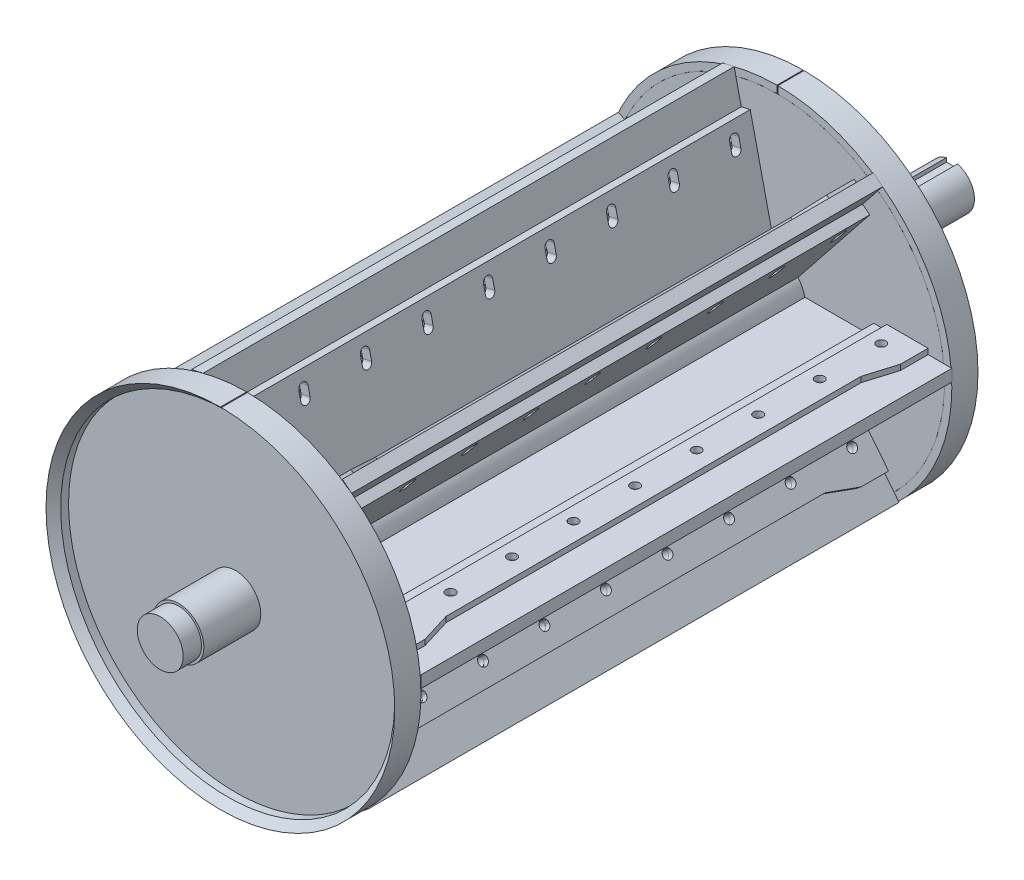
from build123d import *

# Parameters (mm, degrees)
SKETCH1_R                = 189.85
BOSS_EXTRUDE1_DEPTH      = 24
SKETCH2_R                = 189.85
BOSS_EXTRUDE2_DEPTH      = 24
BOSS_EXTRUDE3_REACH      = 661.159
SKETCH3_R                = 30
SKETCH5_R                = 27.5
BOSS_EXTRUDE4_DEPTH      = 50
SKETCH6_R                = 27.5
BOSS_EXTRUDE5_DEPTH      = 50
SKETCH16_R               = 186.07405166
SKETCH16_R_2             = 27.5
CUT_EXTRUDE2_DEPTH       = 12
SKETCH18_R               = 186.07405166
SKETCH18_R_2             = 27.5
CUT_EXTRUDE3_DEPTH       = 12
BOSS_EXTRUDE6_DEPTH      = 5
BOSS_EXTRUDE6_DEPTH_BACK = 5
SKETCH8_W                = 85
SKETCH8_H                = 578.150129005
SKETCH8_R                = 5
BOSS_EXTRUDE8_DEPTH      = 13
SKETCH9_R                = 5
BOSS_EXTRUDE9_DEPTH      = 6
CIRPATTERN1_COUNT        = 7
SKETCH10_R               = 25
BOSS_EXTRUDE10_DEPTH     = 45
SKETCH12_R               = 24.5
BOSS_EXTRUDE11_DEPTH     = 71
SKETCH13_W               = 12
SKETCH13_H               = 10
CUT_EXTRUDE1_DEPTH       = 70
FILLET1_R                = 6
SKETCH14_R               = 25
BOSS_EXTRUDE12_DEPTH     = 20
CUT_EXTRUDE4_DEPTH       = 40
CUT_EXTRUDE4_DEPTH_BACK  = 12
SKETCH19_R               = 189.85
SKETCH19_R_2             = 181.85
BASE_FLANGE1_DEPTH       = 28.5
CHAMFER1_SIZE            = 8
CUT_EXTRUDE5_DEPTH       = 30
CUT_EXTRUDE5_DEPTH_BACK  = 12
SKETCH21_R               = 189.85
SKETCH21_R_2             = 181.85
BASE_FLANGE2_DEPTH       = 28.5
CHAMFER2_SIZE            = 8


# Sheet-metal steps are written as plain solids
# Some blends are built 0.0001 mm under size
with BuildPart() as part:
    # Sketch1 → Boss-Extrude1 (new body)
    with BuildSketch(Plane.XY):
        Circle(SKETCH1_R)
    extrude(amount=BOSS_EXTRUDE1_DEPTH)


with BuildPart() as body_2:
    # Sketch2 → Boss-Extrude2 (new body)
    with BuildSketch(Plane(origin=(0, 0, 626), x_dir=(-1, 0, 0), z_dir=(0, 0, -1))):
        with Locations(Location((0, 0, 0), (0, 0, 180))):
            Circle(SKETCH2_R)
    extrude(amount=BOSS_EXTRUDE2_DEPTH)

    # Sketch3 → Boss-Extrude3 (add, up to next)
    with BuildSketch(Plane.XY.offset(24), mode=Mode.PRIVATE) as boss_extrude3_sk1:
        with Locations(Location((0, 0, 0), (0, 0, 180))):
            Circle(SKETCH3_R)
    boss_extrude3_tool1 = extrude(boss_extrude3_sk1.sketch, amount=BOSS_EXTRUDE3_REACH, mode=Mode.PRIVATE) - body_2.part

    add(part.part)  # Boss-Extrude3 merges part
    add(boss_extrude3_tool1.solids().sort_by_distance((0, 0, 24))[0])

    # Sketch4 → Revolve1 (revolve)
    with BuildSketch(Plane(origin=(0, 0, 0), x_dir=(1, 0, 0), z_dir=(0, 1, 0)), mode=Mode.PRIVATE) as revolve1_sk:
        Polygon((189.85, -626), (189.85, -630.5), (186.07405166, -626), align=None)
        Polygon((186.07405166, 0), (189.85, 0), (189.85, 4.5), align=None)
    revolve(revolve1_sk.sketch.rotate(Axis((0, 0, 0), (0, 0, 1)), 180), axis=Axis((0, 0, 0), (0, 0, 1)))

    # Sketch5 → Boss-Extrude4 (add)
    with BuildSketch(Plane(origin=(0, 0, 0), x_dir=(-1, 0, 0), z_dir=(0, 0, -1))):
        with Locations(Location((0, 0, 0), (0, 0, 180))):
            Circle(SKETCH5_R)
    extrude(amount=BOSS_EXTRUDE4_DEPTH)

    # Sketch6 → Boss-Extrude5 (add)
    with BuildSketch(Plane.XY.offset(626)):
        Circle(SKETCH6_R)
    extrude(amount=BOSS_EXTRUDE5_DEPTH)

    # Sketch16 → Cut-Extrude2 (cut)
    with BuildSketch(Plane.XY.offset(626)):
        Circle(SKETCH16_R)
        Circle(SKETCH16_R_2, mode=Mode.SUBTRACT)
    extrude(amount=-CUT_EXTRUDE2_DEPTH, mode=Mode.SUBTRACT)

    # Sketch18 → Cut-Extrude3 (cut)
    with BuildSketch(Plane(origin=(0, 0, 0), x_dir=(-1, 0, 0), z_dir=(0, 0, -1))):
        with Locations(Location((0, 0, 0), (0, 0, 180))):
            Circle(SKETCH18_R)
        with Locations(Location((0, 0, 0), (0, 0, 180))):
            Circle(SKETCH18_R_2, mode=Mode.SUBTRACT)
    extrude(amount=-CUT_EXTRUDE3_DEPTH, mode=Mode.SUBTRACT)

    # Sketch10 → Boss-Extrude10 (add)
    with BuildSketch(Plane(origin=(0, 0, -50), x_dir=(-1, 0, 0), z_dir=(0, 0, -1))):
        with Locations(Location((0, 0, 0), (0, 0, 180))):
            Circle(SKETCH10_R)
    extrude(amount=BOSS_EXTRUDE10_DEPTH)

    # Sketch12 → Boss-Extrude11 (add)
    with BuildSketch(Plane(origin=(0, 0, -95), x_dir=(-1, 0, 0), z_dir=(0, 0, -1))):
        Circle(SKETCH12_R)
    extrude(amount=BOSS_EXTRUDE11_DEPTH)

    # Sketch13 → Cut-Extrude1 (cut)
    with BuildSketch(Plane(origin=(0, 0, -166), x_dir=(-1, 0, 0), z_dir=(0, 0, -1))):
        with Locations((0, 24.5)):
            Rectangle(SKETCH13_W, SKETCH13_H)
    extrude(amount=-CUT_EXTRUDE1_DEPTH, mode=Mode.SUBTRACT)

    # Fillet1
    # the kernel refuses this fillet: 6 mm, written as the material it adds along each edge
    with BuildSketch(Plane(origin=(6, 38.75394704, -96), x_dir=(0, 0, -1), z_dir=(0, -1, 0))) as fillet1_piece_1_section:
        with BuildLine():
            CenterArc((FILLET1_R, -FILLET1_R), FILLET1_R, 90, 90)
            Line((0, -FILLET1_R), (0, 0))
            Line((0, 0), (FILLET1_R, 0))
        make_face()
    fillet1_piece_1 = extrude(amount=34.25394704, mode=Mode.PRIVATE)
    fillet1_piece_1 = fillet1_piece_1 & Plane(origin=(0, 0, -97.319866537), x_dir=(-1, 0, 0), z_dir=(0, 0, 1)) * Cylinder(24.5, 93, mode=Mode.PRIVATE)
    add(fillet1_piece_1)
    with BuildSketch(Plane(origin=(-6, 4.5, -96), x_dir=(1, 0, 0), z_dir=(0, 1, 0))) as fillet1_piece_2_section:
        with BuildLine():
            CenterArc((FILLET1_R, FILLET1_R), FILLET1_R, 180, 90)
            Line((0, FILLET1_R), (0, 0))
            Line((0, 0), (FILLET1_R, 0))
        make_face()
    fillet1_piece_2 = extrude(amount=34.25394704, mode=Mode.PRIVATE)
    fillet1_piece_2 = fillet1_piece_2 & Plane(origin=(0, 0, -97.358370686), x_dir=(-1, 0, 0), z_dir=(0, 0, 1)) * Cylinder(24.5, 93, mode=Mode.PRIVATE)
    add(fillet1_piece_2)

    # Sketch14 → Boss-Extrude12 (add)
    with BuildSketch(Plane.XY.offset(676)):
        Circle(SKETCH14_R)
    extrude(amount=BOSS_EXTRUDE12_DEPTH)


with BuildPart() as body_2_2:
    # Sketch7 → Boss-Extrude6 (new, two sides: drawn at the far end of the back side and taken through both)
    with BuildSketch(Plane(origin=(0, 0, 0), x_dir=(1, 0, 0), z_dir=(0, 1, 0)).offset(-BOSS_EXTRUDE6_DEPTH_BACK)):
        Polygon((30, -24), (30, -602), (155, -602), (155, -539), (155, -87), (155, -24), align=None)
        with BuildLine():
            Line((129, -308), (139, -308))
            ThreePointArc((139, -308), (144, -313), (139, -318))
            Line((139, -318), (129, -318))
            ThreePointArc((129, -318), (124, -313), (129, -308))
        make_face(mode=Mode.SUBTRACT)
        with BuildLine():
            Line((129, -241), (139, -241))
            ThreePointArc((139, -241), (144, -246), (139, -251))
            Line((139, -251), (129, -251))
            ThreePointArc((129, -251), (124, -246), (129, -241))
        make_face(mode=Mode.SUBTRACT)
        with BuildLine():
            Line((129, -174), (139, -174))
            ThreePointArc((139, -174), (144, -179), (139, -184))
            Line((139, -184), (129, -184))
            ThreePointArc((129, -184), (124, -179), (129, -174))
        make_face(mode=Mode.SUBTRACT)
        with BuildLine():
            Line((129, -107), (139, -107))
            ThreePointArc((139, -107), (144, -112), (139, -117))
            Line((139, -117), (129, -117))
            ThreePointArc((129, -117), (124, -112), (129, -107))
        make_face(mode=Mode.SUBTRACT)
        with BuildLine():
            Line((129, -40), (139, -40))
            ThreePointArc((139, -40), (144, -45), (139, -50))
            Line((139, -50), (129, -50))
            ThreePointArc((129, -50), (124, -45), (129, -40))
        make_face(mode=Mode.SUBTRACT)
        with BuildLine():
            Line((129, -385), (139, -385))
            ThreePointArc((139, -385), (144, -380), (139, -375))
            Line((139, -375), (129, -375))
            ThreePointArc((129, -375), (124, -380), (129, -385))
        make_face(mode=Mode.SUBTRACT)
        with BuildLine():
            Line((129, -452), (139, -452))
            ThreePointArc((139, -452), (144, -447), (139, -442))
            Line((139, -442), (129, -442))
            ThreePointArc((129, -442), (124, -447), (129, -452))
        make_face(mode=Mode.SUBTRACT)
        with BuildLine():
            Line((129, -519), (139, -519))
            ThreePointArc((139, -519), (144, -514), (139, -509))
            Line((139, -509), (129, -509))
            ThreePointArc((129, -509), (124, -514), (129, -519))
        make_face(mode=Mode.SUBTRACT)
        with BuildLine():
            Line((129, -586), (139, -586))
            ThreePointArc((139, -586), (144, -581), (139, -576))
            Line((139, -576), (129, -576))
            ThreePointArc((129, -576), (124, -581), (129, -586))
        make_face(mode=Mode.SUBTRACT)
    extrude(amount=BOSS_EXTRUDE6_DEPTH + BOSS_EXTRUDE6_DEPTH_BACK)


with BuildPart() as body_3:
    # Sketch8 → Boss-Extrude8 (new body)
    with BuildSketch(Plane(origin=(0, 5, 0), x_dir=(1, 0, 0), z_dir=(0, 1, 0))):
        with Locations((147.35, -312.976376086)):
            Rectangle(SKETCH8_W, SKETCH8_H)
        with Locations(Location((134, -313, 0), (0, 0, 90))):
            Circle(SKETCH8_R, mode=Mode.SUBTRACT)
        with Locations(Location((134, -246, 0), (0, 0, 90))):
            Circle(SKETCH8_R, mode=Mode.SUBTRACT)
        with Locations(Location((134, -179, 0), (0, 0, 90))):
            Circle(SKETCH8_R, mode=Mode.SUBTRACT)
        with Locations(Location((134, -112, 0), (0, 0, 90))):
            Circle(SKETCH8_R, mode=Mode.SUBTRACT)
        with Locations(Location((134, -45, 0), (0, 0, 90))):
            Circle(SKETCH8_R, mode=Mode.SUBTRACT)
        with Locations(Location((134, -581, 0), (0, 0, 90))):
            Circle(SKETCH8_R, mode=Mode.SUBTRACT)
        with Locations(Location((134, -514, 0), (0, 0, 90))):
            Circle(SKETCH8_R, mode=Mode.SUBTRACT)
        with Locations(Location((134, -447, 0), (0, 0, 90))):
            Circle(SKETCH8_R, mode=Mode.SUBTRACT)
        with Locations(Location((134, -380, 0), (0, 0, 90))):
            Circle(SKETCH8_R, mode=Mode.SUBTRACT)
    extrude(amount=BOSS_EXTRUDE8_DEPTH)


with BuildPart() as body_4:
    # Sketch9 → Boss-Extrude9 (new body)
    with BuildSketch(Plane(origin=(0, 18, 0), x_dir=(1, 0, 0), z_dir=(0, 1, 0))):
        Polygon((119, -23.901311583), (119, -602.051440588), (163.351859714, -602.051440588), (164.473330949, -602.049178765), (164.424208848, -572.049218982), (154.370187942, -539.065637254), (154, -86.901311583), (164, -53.901311583), (164, -23.901311583), align=None)
        with BuildLine():
            ThreePointArc((134.215322484, -576.004638529), (139.438822426, -580.995547223), (134.223501618, -585.995002205))
            ThreePointArc((134.223501618, -585.995002205), (129.000001676, -581.00409351), (134.215322484, -576.004638529))
        make_face(mode=Mode.SUBTRACT)
        with BuildLine():
            ThreePointArc((134.160467745, -509.002575653), (139.329116401, -513.99563704), (134.168650331, -518.997154897))
            ThreePointArc((134.168650331, -518.997154897), (129.000001676, -514.004093511), (134.160467745, -509.002575653))
        make_face(mode=Mode.SUBTRACT)
        with BuildLine():
            ThreePointArc((134.105613499, -442.001115546), (139.219410375, -446.995726856), (134.113798551, -451.998704821))
            ThreePointArc((134.113798551, -451.998704821), (129.000001676, -447.004093511), (134.105613499, -442.001115546))
        make_face(mode=Mode.SUBTRACT)
        with BuildLine():
            ThreePointArc((134.050759746, -375.000257662), (139.10970435, -379.995816671), (134.058946278, -384.999652522))
            ThreePointArc((134.058946278, -384.999652522), (129.000001676, -380.004093512), (134.050759746, -375.000257662))
        make_face(mode=Mode.SUBTRACT)
        with Locations(Location((134, -313, 0), (0, 0, 270))):
            Circle(SKETCH9_R, mode=Mode.SUBTRACT)
        with Locations(Location((134, -246, 0), (0, 0, 270))):
            Circle(SKETCH9_R, mode=Mode.SUBTRACT)
        with Locations(Location((134, -179, 0), (0, 0, 270))):
            Circle(SKETCH9_R, mode=Mode.SUBTRACT)
        with Locations(Location((134, -112, 0), (0, 0, 270))):
            Circle(SKETCH9_R, mode=Mode.SUBTRACT)
        with Locations(Location((134, -45, 0), (0, 0, 270))):
            Circle(SKETCH9_R, mode=Mode.SUBTRACT)
    extrude(amount=BOSS_EXTRUDE9_DEPTH)


with BuildPart() as cirpattern1_1:
    # CirPattern1: pattern copy
    add(body_4.part.rotate(Axis((0, 0, 0), (0, 0, 1)), 1 * 360 / CIRPATTERN1_COUNT))


with BuildPart() as cirpattern1_2:
    # CirPattern1: pattern copy
    add(body_4.part.rotate(Axis((0, 0, 0), (0, 0, 1)), 2 * 360 / CIRPATTERN1_COUNT))


with BuildPart() as cirpattern1_3:
    # CirPattern1: pattern copy
    add(body_4.part.rotate(Axis((0, 0, 0), (0, 0, 1)), 3 * 360 / CIRPATTERN1_COUNT))


with BuildPart() as cirpattern1_4:
    # CirPattern1: pattern copy
    add(body_4.part.rotate(Axis((0, 0, 0), (0, 0, 1)), 4 * 360 / CIRPATTERN1_COUNT))


with BuildPart() as cirpattern1_5:
    # CirPattern1: pattern copy
    add(body_4.part.rotate(Axis((0, 0, 0), (0, 0, 1)), 5 * 360 / CIRPATTERN1_COUNT))


with BuildPart() as cirpattern1_6:
    # CirPattern1: pattern copy
    add(body_4.part.rotate(Axis((0, 0, 0), (0, 0, 1)), 6 * 360 / CIRPATTERN1_COUNT))


with BuildPart() as cirpattern1_7:
    # CirPattern1: pattern copy
    add(body_3.part.rotate(Axis((0, 0, 0), (0, 0, 1)), 1 * 360 / CIRPATTERN1_COUNT))


with BuildPart() as cirpattern1_8:
    # CirPattern1: pattern copy
    add(body_3.part.rotate(Axis((0, 0, 0), (0, 0, 1)), 2 * 360 / CIRPATTERN1_COUNT))


with BuildPart() as cirpattern1_9:
    # CirPattern1: pattern copy
    add(body_3.part.rotate(Axis((0, 0, 0), (0, 0, 1)), 3 * 360 / CIRPATTERN1_COUNT))


with BuildPart() as cirpattern1_10:
    # CirPattern1: pattern copy
    add(body_3.part.rotate(Axis((0, 0, 0), (0, 0, 1)), 4 * 360 / CIRPATTERN1_COUNT))


with BuildPart() as cirpattern1_11:
    # CirPattern1: pattern copy
    add(body_3.part.rotate(Axis((0, 0, 0), (0, 0, 1)), 5 * 360 / CIRPATTERN1_COUNT))


with BuildPart() as cirpattern1_12:
    # CirPattern1: pattern copy
    add(body_3.part.rotate(Axis((0, 0, 0), (0, 0, 1)), 6 * 360 / CIRPATTERN1_COUNT))


with BuildPart() as cirpattern1_13:
    # CirPattern1: pattern copy
    add(body_2_2.part.rotate(Axis((0, 0, 0), (0, 0, 1)), 1 * 360 / CIRPATTERN1_COUNT))


with BuildPart() as cirpattern1_14:
    # CirPattern1: pattern copy
    add(body_2_2.part.rotate(Axis((0, 0, 0), (0, 0, 1)), 2 * 360 / CIRPATTERN1_COUNT))


with BuildPart() as cirpattern1_15:
    # CirPattern1: pattern copy
    add(body_2_2.part.rotate(Axis((0, 0, 0), (0, 0, 1)), 3 * 360 / CIRPATTERN1_COUNT))


with BuildPart() as cirpattern1_16:
    # CirPattern1: pattern copy
    add(body_2_2.part.rotate(Axis((0, 0, 0), (0, 0, 1)), 4 * 360 / CIRPATTERN1_COUNT))


with BuildPart() as cirpattern1_17:
    # CirPattern1: pattern copy
    add(body_2_2.part.rotate(Axis((0, 0, 0), (0, 0, 1)), 5 * 360 / CIRPATTERN1_COUNT))


with BuildPart() as cirpattern1_18:
    # CirPattern1: pattern copy
    add(body_2_2.part.rotate(Axis((0, 0, 0), (0, 0, 1)), 6 * 360 / CIRPATTERN1_COUNT))


with BuildPart() as cut_extrude4_tool:
    # Sketch19 → Cut-Extrude4 (new, two sides: drawn at the far end of the back side and taken through both)
    with BuildSketch(Plane(origin=(0, 0, 12), x_dir=(-1, 0, 0), z_dir=(0, 0, -1)).offset(-CUT_EXTRUDE4_DEPTH_BACK)):
        Circle(SKETCH19_R)
        Circle(SKETCH19_R_2, mode=Mode.SUBTRACT)
    extrude(amount=CUT_EXTRUDE4_DEPTH + CUT_EXTRUDE4_DEPTH_BACK)


with BuildPart() as body_2_1:
    add(body_2.part)

    # Cut-Extrude4: cut by cut_extrude4_tool
    add(cut_extrude4_tool.part, mode=Mode.SUBTRACT)


with BuildPart() as body_3_1:
    add(body_3.part)

    # Cut-Extrude4: cut by cut_extrude4_tool
    add(cut_extrude4_tool.part, mode=Mode.SUBTRACT)


with BuildPart() as cirpattern1_7_1:
    add(cirpattern1_7.part)

    # Cut-Extrude4: cut by cut_extrude4_tool
    add(cut_extrude4_tool.part, mode=Mode.SUBTRACT)


with BuildPart() as cirpattern1_8_1:
    add(cirpattern1_8.part)

    # Cut-Extrude4: cut by cut_extrude4_tool
    add(cut_extrude4_tool.part, mode=Mode.SUBTRACT)


with BuildPart() as cirpattern1_9_1:
    add(cirpattern1_9.part)

    # Cut-Extrude4: cut by cut_extrude4_tool
    add(cut_extrude4_tool.part, mode=Mode.SUBTRACT)


with BuildPart() as cirpattern1_10_1:
    add(cirpattern1_10.part)

    # Cut-Extrude4: cut by cut_extrude4_tool
    add(cut_extrude4_tool.part, mode=Mode.SUBTRACT)


with BuildPart() as cirpattern1_11_1:
    add(cirpattern1_11.part)

    # Cut-Extrude4: cut by cut_extrude4_tool
    add(cut_extrude4_tool.part, mode=Mode.SUBTRACT)


with BuildPart() as cirpattern1_12_1:
    add(cirpattern1_12.part)

    # Cut-Extrude4: cut by cut_extrude4_tool
    add(cut_extrude4_tool.part, mode=Mode.SUBTRACT)


with BuildPart() as body_23:
    # Sketch20 → Base-Flange1 (new body)
    with BuildSketch(Plane.XY.offset(24)):
        with BuildLine():
            ThreePointArc((-0.499999528, 181.84931262), (0, -181.85), (0.499999528, 181.84931262))
            Line((0.499999528, 181.84931262), (0.521995657, 189.849282381))
            ThreePointArc((0.521995657, 189.849282381), (0, -189.85), (-0.521995657, 189.849282381))
            Line((-0.521995657, 189.849282381), (-0.499999528, 181.84931262))
        make_face()
    extrude(amount=-BASE_FLANGE1_DEPTH)

    # Chamfer1
    chamfer1_edges = [body_23.edges().sort_by_distance(p)[0] for p in [
        (0, -181.85, -4.5),
    ]]
    chamfer(chamfer1_edges, length=CHAMFER1_SIZE - 0.0001)  # a hair under: the kernel refuses the full size


with BuildPart() as cut_extrude5_tool:
    # Sketch21 → Cut-Extrude5 (new, two sides: drawn at the far end of the back side and taken through both)
    with BuildSketch(Plane.XY.offset(614).offset(-CUT_EXTRUDE5_DEPTH_BACK)):
        Circle(SKETCH21_R)
        with Locations(Location((0, 0, 0), (0, 0, 180))):
            Circle(SKETCH21_R_2, mode=Mode.SUBTRACT)
    extrude(amount=CUT_EXTRUDE5_DEPTH + CUT_EXTRUDE5_DEPTH_BACK)


with BuildPart() as body_2_3:
    add(body_2_1.part)

    # Cut-Extrude5: cut by cut_extrude5_tool
    add(cut_extrude5_tool.part, mode=Mode.SUBTRACT)


with BuildPart() as body_3_2:
    add(body_3_1.part)

    # Cut-Extrude5: cut by cut_extrude5_tool
    add(cut_extrude5_tool.part, mode=Mode.SUBTRACT)


with BuildPart() as cirpattern1_7_2:
    add(cirpattern1_7_1.part)

    # Cut-Extrude5: cut by cut_extrude5_tool
    add(cut_extrude5_tool.part, mode=Mode.SUBTRACT)


with BuildPart() as cirpattern1_8_2:
    add(cirpattern1_8_1.part)

    # Cut-Extrude5: cut by cut_extrude5_tool
    add(cut_extrude5_tool.part, mode=Mode.SUBTRACT)


with BuildPart() as cirpattern1_9_2:
    add(cirpattern1_9_1.part)

    # Cut-Extrude5: cut by cut_extrude5_tool
    add(cut_extrude5_tool.part, mode=Mode.SUBTRACT)


with BuildPart() as cirpattern1_10_2:
    add(cirpattern1_10_1.part)

    # Cut-Extrude5: cut by cut_extrude5_tool
    add(cut_extrude5_tool.part, mode=Mode.SUBTRACT)


with BuildPart() as cirpattern1_11_2:
    add(cirpattern1_11_1.part)

    # Cut-Extrude5: cut by cut_extrude5_tool
    add(cut_extrude5_tool.part, mode=Mode.SUBTRACT)


with BuildPart() as cirpattern1_12_2:
    add(cirpattern1_12_1.part)

    # Cut-Extrude5: cut by cut_extrude5_tool
    add(cut_extrude5_tool.part, mode=Mode.SUBTRACT)


with BuildPart() as body_24:
    # Sketch23 → Base-Flange2 (new body)
    with BuildSketch(Plane(origin=(0, 0, 602), x_dir=(-1, 0, 0), z_dir=(0, 0, -1))):
        with BuildLine():
            ThreePointArc((-0.999995275, 181.847250486), (0.499999528, -181.84931262), (0, 181.85))
            Line((0, 181.85), (0, 189.85))
            ThreePointArc((0, 189.85), (0.521995657, -189.849282381), (-1.043987369, 189.847129529))
            Line((-1.043987369, 189.847129529), (-0.999995275, 181.847250486))
        make_face()
    extrude(amount=-BASE_FLANGE2_DEPTH)

    # Chamfer2
    chamfer2_edges = [body_24.edges().sort_by_distance(p)[0] for p in [
        (-0.499999528, -181.84931262, 630.5),
    ]]
    chamfer(chamfer2_edges, length=CHAMFER2_SIZE - 0.0001)  # a hair under: the kernel refuses the full size


solid = Compound([body_2_2.part, body_4.part, cirpattern1_1.part, cirpattern1_2.part, cirpattern1_3.part, cirpattern1_4.part, cirpattern1_5.part, cirpattern1_6.part, cirpattern1_13.part, cirpattern1_14.part, cirpattern1_15.part, cirpattern1_16.part, cirpattern1_17.part, cirpattern1_18.part, body_23.part, body_2_3.part, body_3_2.part, cirpattern1_7_2.part, cirpattern1_8_2.part, cirpattern1_9_2.part, cirpattern1_10_2.part, cirpattern1_11_2.part, cirpattern1_12_2.part, body_24.part])
